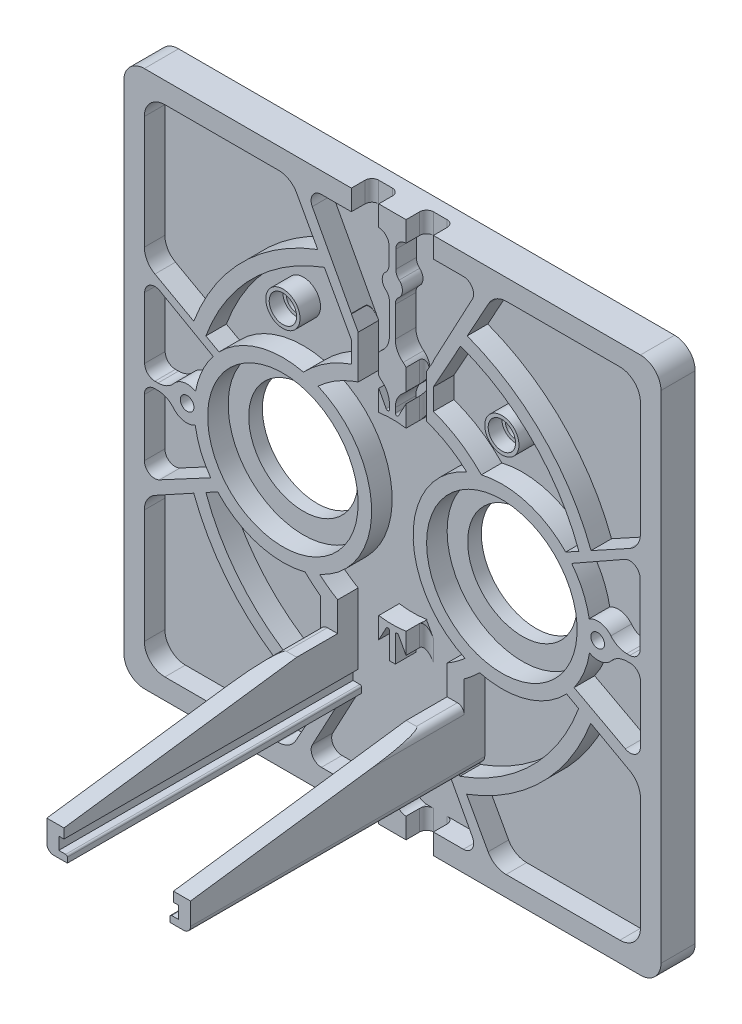
from build123d import *

# Parameters (mm, degrees)
EXTRUDE_2_DEPTH          = 5
SKETCH_6_R               = 13
CUT_EXTRUDE_2_DEPTH      = 3
CUT_EXTRUDE_4_DEPTH      = 3
SKETCH_12_R              = 18
SKETCH_12_R_2            = 16
EXTRUDE_7_DEPTH          = 3
SKETCH_18_R              = 31
SKETCH_18_R_2            = 29
EXTRUDE_10_DEPTH         = 3
CUT_EXTRUDE_7_DEPTH      = 3
CUT_EXTRUDE_7_DEPTH_BACK = 2
SKETCH_19_R              = 1
CHAMFER_6_SIZE           = 2
CUT_EXTRUDE_8_DEPTH      = 3
CUT_EXTRUDE_12_DEPTH     = 78.5
EXTRUDE_12_DEPTH         = 3
EXTRUDE_15_DEPTH         = 43
CUT_EXTRUDE_13_DEPTH     = 22
CUT_EXTRUDE_START        = -3
CUT_EXTRUDE_17_DEPTH     = 3
EXTRUDE_14_DEPTH         = 3
EXTRUDE_16_DEPTH         = 3
SKETCH_50_R              = 11
CUT_EXTRUDE_18_DEPTH     = 3
SKETCH_48_R              = 8.001672056
SKETCH_48_R_2            = 8
CUT_EXTRUDE_19_DEPTH     = 3
SKETCH_51_R              = 2.5
EXTRUDE_17_DEPTH         = 3
SKETCH_53_R              = 2
CUT_EXTRUDE_21_DEPTH     = 2
SKETCH_54_R              = 1.5
CUT_EXTRUDE_22_DEPTH     = 3


with BuildPart() as part:
    # Эскиз1 → Бобышка-Вытянуть2 (new body)
    with BuildSketch(Plane.XY):
        with BuildLine():
            Line((-36.25, -39.25), (36.25, -39.25))
            ThreePointArc((36.25, -39.25), (38.371320344, -38.371320344), (39.25, -36.25))
            Line((39.25, -36.25), (39.25, 36.25))
            ThreePointArc((39.25, 36.25), (38.371320344, 38.371320344), (36.25, 39.25))
            Line((36.25, 39.25), (-36.25, 39.25))
            ThreePointArc((-36.25, 39.25), (-38.371320344, 38.371320344), (-39.25, 36.25))
            Line((-39.25, 36.25), (-39.25, -36.25))
            ThreePointArc((-39.25, -36.25), (-38.371320344, -38.371320344), (-36.25, -39.25))
        make_face()
    extrude(amount=EXTRUDE_2_DEPTH)

    # Эскиз6 → Вырез-Вытянуть2 (cut)
    with BuildSketch(Plane.XY.offset(5)):
        Circle(SKETCH_6_R)
    extrude(amount=-CUT_EXTRUDE_2_DEPTH, mode=Mode.SUBTRACT)

    # Эскиз10 → Вырез-Вытянуть4 (cut)
    with BuildSketch(Plane.XY.offset(5)):
        with BuildLine():
            Line((-36.25, -33.25), (-36.25, -16.619482512))
            ThreePointArc((-36.25, -16.619482512), (-35.831646193, -15.091378152), (-34.69326471, -13.989465977))
            Line((-34.69326471, -13.989465977), (-12.845232579, -2))
            Line((-12.845232579, -2), (-2, -12.845232579))
            Line((-2, -12.845232579), (-14.087577933, -34.701877693))
            ThreePointArc((-14.087577933, -34.701877693), (-15.18897836, -35.834147159), (-16.712849569, -36.25))
            Line((-16.712849569, -36.25), (-33.25, -36.25))
            ThreePointArc((-33.25, -36.25), (-35.371320344, -35.371320344), (-36.25, -33.25))
        make_face()
        with BuildLine():
            Line((36.248456545, 33.245281978), (36.248456545, 16.61476449))
            ThreePointArc((36.248456545, 16.61476449), (35.830102738, 15.08666013), (34.691721255, 13.984747955))
            Line((34.691721255, 13.984747955), (12.843689124, 1.995281978))
            Line((12.843689124, 1.995281978), (1.998456545, 12.840514557))
            Line((1.998456545, 12.840514557), (14.086034478, 34.697159671))
            ThreePointArc((14.086034478, 34.697159671), (15.187434905, 35.829429137), (16.711306114, 36.245281978))
            Line((16.711306114, 36.245281978), (33.248456545, 36.245281978))
            ThreePointArc((33.248456545, 36.245281978), (35.369776888, 35.366602321), (36.248456545, 33.245281978))
        make_face()
        with BuildLine():
            Line((33.245281978, -36.317324444), (16.61476449, -36.317324444))
            ThreePointArc((16.61476449, -36.317324444), (15.08666013, -35.898970637), (13.984747955, -34.760589154))
            Line((13.984747955, -34.760589154), (1.995281978, -12.912557022))
            Line((1.995281978, -12.912557022), (12.840514557, -2.067324444))
            Line((12.840514557, -2.067324444), (34.697159671, -14.154902376))
            ThreePointArc((34.697159671, -14.154902376), (35.829429137, -15.256302804), (36.245281978, -16.780174013))
            Line((36.245281978, -16.780174013), (36.245281978, -33.317324444))
            ThreePointArc((36.245281978, -33.317324444), (35.366602321, -35.438644787), (33.245281978, -36.317324444))
        make_face()
        with BuildLine():
            Line((-33.25, 36.181132101), (-16.619482512, 36.181132101))
            ThreePointArc((-16.619482512, 36.181132101), (-15.091378152, 35.762778294), (-13.989465977, 34.624396812))
            Line((-13.989465977, 34.624396812), (-2, 12.77636468))
            Line((-2, 12.77636468), (-12.845232579, 1.931132101))
            Line((-12.845232579, 1.931132101), (-34.701877693, 14.018710034))
            ThreePointArc((-34.701877693, 14.018710034), (-35.834147159, 15.120110462), (-36.25, 16.64398167))
            Line((-36.25, 16.64398167), (-36.25, 33.181132101))
            ThreePointArc((-36.25, 33.181132101), (-35.371320344, 35.302452445), (-33.25, 36.181132101))
        make_face()
    extrude(amount=-CUT_EXTRUDE_4_DEPTH, mode=Mode.SUBTRACT)

    # Эскиз12 → Бобышка-Вытянуть7 (add)
    with BuildSketch(Plane.XY.offset(2)):
        Circle(SKETCH_12_R)
        Circle(SKETCH_12_R_2, mode=Mode.SUBTRACT)
    extrude(amount=EXTRUDE_7_DEPTH)

    # Эскиз18 → Бобышка-Вытянуть10 (add)
    with BuildSketch(Plane.XY.offset(2)):
        Circle(SKETCH_18_R)
        Circle(SKETCH_18_R_2, mode=Mode.SUBTRACT)
    extrude(amount=EXTRUDE_10_DEPTH)

    # Эскиз19 → Вырез-Вытянуть7 (cut, two sides: drawn at the far end of the back side and taken through both)
    with BuildSketch(Plane.XY.offset(2).offset(-CUT_EXTRUDE_7_DEPTH_BACK)):
        with Locations((-30, 0)):
            Circle(SKETCH_19_R)
        with Locations((30, 0)):
            Circle(SKETCH_19_R)
    extrude(amount=CUT_EXTRUDE_7_DEPTH + CUT_EXTRUDE_7_DEPTH_BACK, mode=Mode.SUBTRACT)

    # Фаска6
    chamfer_6_edges = [part.edges().sort_by_distance(p)[0] for p in [
        (-31, 0, 0),
        (29, 0, 0),
    ]]
    chamfer(chamfer_6_edges, length=CHAMFER_6_SIZE - 0.0001)  # a hair under: the kernel refuses the full size

    # Эскиз21 → Вырез-Вытянуть8 (cut)
    with BuildSketch(Plane.XY.offset(5)):
        with BuildLine():
            Line((-34.704620743, 0.454307302), (-34.254311921, 0.454307302))
            ThreePointArc((-34.254311921, 0.454307302), (-32.975007388, 0.740752454), (-31.940003243, 1.545387361))
            ThreePointArc((-31.940003243, 1.545387361), (-29.988572961, 2.454516411), (-28.054079136, 1.509884517))
            ThreePointArc((-28.054079136, 1.509884517), (-27.009013247, 0.674298621), (-25.704595988, 0.376201124))
            Line((-25.704595988, 0.376201124), (-13.943899103, 0.378878245))
            ThreePointArc((-13.943899103, 0.378878245), (-13.702182333, 0.565274083), (-13.820883988, 0.84648632))
            Line((-13.820883988, 0.84648632), (-33.966188607, 12.240012563))
            ThreePointArc((-33.966188607, 12.240012563), (-35.460382543, 12.23005852), (-36.204620743, 10.934364073))
            Line((-36.204620743, 10.934364073), (-36.204620743, 1.954307302))
            ThreePointArc((-36.204620743, 1.954307302), (-35.765280915, 0.89364713), (-34.704620743, 0.454307302))
        make_face()
        with BuildLine():
            Line((-25.761044938, -0.43461173), (-13.989761952, -0.43461173))
            ThreePointArc((-13.989761952, -0.43461173), (-13.747273757, -0.623788417), (-13.871770468, -0.905015927))
            Line((-13.871770468, -0.905015927), (-34.04205417, -11.703003176))
            ThreePointArc((-34.04205417, -11.703003176), (-35.520741889, -11.667419743), (-36.250003072, -10.380577998))
            Line((-36.250003072, -10.380577998), (-36.250003072, -2.005063818))
            ThreePointArc((-36.250003072, -2.005063818), (-35.810660174, -0.944400576), (-34.749994387, -0.505063818))
            Line((-34.749994387, -0.505063818), (-34.295230554, -0.505066451))
            ThreePointArc((-34.295230554, -0.505066451), (-33.017657052, -0.79070436), (-31.983362839, -1.593212023))
            ThreePointArc((-31.983362839, -1.593212023), (-30.03615371, -2.499914811), (-28.104179663, -1.56118715))
            ThreePointArc((-28.104179663, -1.56118715), (-27.060992294, -0.730885252), (-25.761044938, -0.43461173))
        make_face()
        with BuildLine():
            Line((-0.495022641, -34.75006596), (-0.495022641, -32.204632927))
            ThreePointArc((-0.495022641, -32.204632927), (-0.623947966, -31.596229906), (-0.988561622, -31.092411628))
            ThreePointArc((-0.988561622, -31.092411628), (-1.473098084, -29.976854334), (-0.953653161, -28.877117715))
            ThreePointArc((-0.953653161, -28.877117715), (-0.563252055, -28.363667136), (-0.424570548, -27.733737013))
            Line((-0.424570548, -27.733737013), (-0.424570548, -13.98982484))
            ThreePointArc((-0.424570548, -13.98982484), (-0.613747234, -13.747336645), (-0.894974744, -13.871833356))
            Line((-0.894974744, -13.871833356), (-11.692961993, -34.042117058))
            ThreePointArc((-11.692961993, -34.042117058), (-11.65737856, -35.520804777), (-10.370536815, -36.25006596))
            Line((-10.370536815, -36.25006596), (-1.995022641, -36.25006596))
            ThreePointArc((-1.995022641, -36.25006596), (-0.934362469, -35.810726132), (-0.495022641, -34.75006596))
        make_face()
        with BuildLine():
            Line((0.43452545, -27.733740085), (0.43452545, -13.989827912))
            ThreePointArc((0.43452545, -13.989827912), (0.623702136, -13.747339717), (0.904929646, -13.871836428))
            Line((0.904929646, -13.871836428), (11.702916895, -34.04212013))
            ThreePointArc((11.702916895, -34.04212013), (11.667333462, -35.520807849), (10.380491717, -36.250069033))
            Line((10.380491717, -36.250069033), (2.004977543, -36.250069033))
            ThreePointArc((2.004977543, -36.250069033), (0.944317371, -35.810729204), (0.504977543, -34.750069033))
            Line((0.504977543, -34.750069033), (0.504977543, -32.204635999))
            ThreePointArc((0.504977543, -32.204635999), (0.633902868, -31.596232978), (0.998516524, -31.0924147))
            ThreePointArc((0.998516524, -31.0924147), (1.483052986, -29.976857406), (0.963608063, -28.877120787))
            ThreePointArc((0.963608063, -28.877120787), (0.573206957, -28.363670209), (0.43452545, -27.733740085))
        make_face()
        with BuildLine():
            Line((0.492820643, 34.75379854), (0.492820643, 32.208365506))
            ThreePointArc((0.492820643, 32.208365506), (0.621745968, 31.599962486), (0.986359624, 31.096144208))
            ThreePointArc((0.986359624, 31.096144208), (1.470896087, 29.980586914), (0.951451164, 28.880850294))
            ThreePointArc((0.951451164, 28.880850294), (0.561050057, 28.367399716), (0.42236855, 27.737469593))
            Line((0.42236855, 27.737469593), (0.42236855, 23.323589505))
            ThreePointArc((0.42236855, 23.323589505), (0.72472932, 22.011056615), (1.570863607, 20.963096029))
            ThreePointArc((1.570863607, 20.963096029), (2.52600545, 19), (1.570863607, 17.036903971))
            ThreePointArc((1.570863607, 17.036903971), (0.72472932, 15.988943385), (0.42236855, 14.676410495))
            Line((0.42236855, 14.676410495), (0.42236855, 13.993557419))
            ThreePointArc((0.42236855, 13.993557419), (0.611545237, 13.751069225), (0.892772746, 13.875565935))
            Line((0.892772746, 13.875565935), (11.690759995, 34.045849637))
            ThreePointArc((11.690759995, 34.045849637), (11.655176563, 35.524537356), (10.368334817, 36.25379854))
            Line((10.368334817, 36.25379854), (1.992820643, 36.25379854))
            ThreePointArc((1.992820643, 36.25379854), (0.932160471, 35.814458712), (0.492820643, 34.75379854))
        make_face()
        with BuildLine():
            Line((-2.00717954, 36.253801612), (-10.382693714, 36.253801612))
            ThreePointArc((-10.382693714, 36.253801612), (-11.669535459, 35.524540429), (-11.705118892, 34.04585271))
            Line((-11.705118892, 34.04585271), (-0.907131643, 13.875569008))
            ThreePointArc((-0.907131643, 13.875569008), (-0.625904134, 13.751072297), (-0.436727447, 13.993560492))
            Line((-0.436727447, 13.993560492), (-0.436727447, 14.729814514))
            ThreePointArc((-0.436727447, 14.729814514), (-0.727107542, 16.017432459), (-1.542034095, 17.055784657))
            ThreePointArc((-1.542034095, 17.055784657), (-2.465929938, 19), (-1.542034095, 20.944215343))
            ThreePointArc((-1.542034095, 20.944215343), (-0.727107542, 21.982567541), (-0.436727447, 23.270185486))
            Line((-0.436727447, 23.270185486), (-0.436727447, 27.737472665))
            ThreePointArc((-0.436727447, 27.737472665), (-0.575408954, 28.367402788), (-0.965810061, 28.880853367))
            ThreePointArc((-0.965810061, 28.880853367), (-1.485254984, 29.980589986), (-1.000718521, 31.09614728))
            ThreePointArc((-1.000718521, 31.09614728), (-0.636104865, 31.599965558), (-0.50717954, 32.208368579))
            Line((-0.50717954, 32.208368579), (-0.50717954, 34.753801612))
            ThreePointArc((-0.50717954, 34.753801612), (-0.946519368, 35.814461784), (-2.00717954, 36.253801612))
        make_face()
        with BuildLine():
            Line((34.749994387, -0.505063818), (34.295230554, -0.505066451))
            ThreePointArc((34.295230554, -0.505066451), (33.017657052, -0.79070436), (31.983362839, -1.593212023))
            ThreePointArc((31.983362839, -1.593212023), (30.03615371, -2.499914811), (28.104179663, -1.56118715))
            ThreePointArc((28.104179663, -1.56118715), (27.060992294, -0.730885252), (25.761044938, -0.43461173))
            Line((25.761044938, -0.43461173), (13.989761952, -0.43461173))
            ThreePointArc((13.989761952, -0.43461173), (13.747273757, -0.623788417), (13.871770468, -0.905015927))
            Line((13.871770468, -0.905015927), (34.04205417, -11.703003176))
            ThreePointArc((34.04205417, -11.703003176), (35.520741889, -11.667419743), (36.250003072, -10.380577998))
            Line((36.250003072, -10.380577998), (36.250003072, -2.005063818))
            ThreePointArc((36.250003072, -2.005063818), (35.810660174, -0.944400576), (34.749994387, -0.505063818))
        make_face()
        with BuildLine():
            Line((34.704620743, 0.454307302), (34.254311921, 0.454307302))
            ThreePointArc((34.254311921, 0.454307302), (32.975007388, 0.740752454), (31.940003243, 1.545387361))
            ThreePointArc((31.940003243, 1.545387361), (29.988572961, 2.454516411), (28.054079136, 1.509884517))
            ThreePointArc((28.054079136, 1.509884517), (27.009013247, 0.674298621), (25.704595988, 0.376201124))
            Line((25.704595988, 0.376201124), (13.943899103, 0.378878245))
            ThreePointArc((13.943899103, 0.378878245), (13.702182333, 0.565274083), (13.820883988, 0.84648632))
            Line((13.820883988, 0.84648632), (33.966188607, 12.240012563))
            ThreePointArc((33.966188607, 12.240012563), (35.460382543, 12.23005852), (36.204620743, 10.934364073))
            Line((36.204620743, 10.934364073), (36.204620743, 1.954307302))
            ThreePointArc((36.204620743, 1.954307302), (35.765280915, 0.89364713), (34.704620743, 0.454307302))
        make_face()
    extrude(amount=-CUT_EXTRUDE_8_DEPTH, mode=Mode.SUBTRACT)

    # Эскиз27 → Вырез-Вытянуть12 (cut)
    with BuildSketch(Plane(origin=(0, -39.25, 0), x_dir=(-1, 0, 0), z_dir=(0, -1, 0))):
        with BuildLine():
            Line((1.995022641, -5), (5.993158737, -5))
            Line((5.993158737, -5), (5.993158737, -3))
            ThreePointArc((5.993158737, -3), (5.700265518, -2.292893219), (4.993158737, -2))
            Line((4.993158737, -2), (2.995022641, -2))
            ThreePointArc((2.995022641, -2), (2.28791586, -2.292893219), (1.995022641, -3))
            Line((1.995022641, -3), (1.995022641, -5))
        make_face()
        with BuildLine():
            Line((-1.995022641, -3), (-1.995022641, -5))
            Line((-1.995022641, -5), (-5.993158737, -5))
            Line((-5.993158737, -5), (-5.993158737, -3))
            ThreePointArc((-5.993158737, -3), (-5.700265518, -2.292893219), (-4.993158737, -2))
            Line((-4.993158737, -2), (-2.995022641, -2))
            ThreePointArc((-2.995022641, -2), (-2.28791586, -2.292893219), (-1.995022641, -3))
        make_face()
    extrude(amount=-CUT_EXTRUDE_12_DEPTH, mode=Mode.SUBTRACT)

    # Эскиз28 → Бобышка-Вытянуть12 (add)
    with BuildSketch(Plane.XY.offset(2)):
        Polygon((-5.993158737, -14.835162566), (-5.993158737, -23.395072746), (-4.993158737, -21.527105759), (-4.993158737, -15.200933058), align=None)
        Polygon((5.993158737, -14.835162566), (5.993158737, -23.37648039), (4.993158737, -21.508513403), (4.993158737, -15.200933058), align=None)
        Polygon((-4.993158737, 15.200933058), (-4.993158737, 21.508132724), (-5.993158737, 23.312460433), (-5.993158737, 14.835162566), align=None)
        Polygon((5.993158737, 14.835162566), (5.993158737, 23.312460433), (4.993158737, 21.534951597), (4.993158737, 15.200933058), align=None)
    extrude(amount=EXTRUDE_12_DEPTH)

    # Эскиз22 → Бобышка-Вытянуть15 (add)
    with BuildSketch(Plane(origin=(0, 48.415106794, 2), x_dir=(1, 0, 0), z_dir=(0, 0, 1))):
        with BuildLine():
            Line((-8.75, -74.361359055), (-7.75, -74.361359055))
            ThreePointArc((-7.75, -74.361359055), (-7.573223305, -74.43458236), (-7.5, -74.611359055))
            Line((-7.5, -74.611359055), (-7.5, -75.361359055))
            Line((-7.5, -75.361359055), (-9.5, -75.361359055))
            ThreePointArc((-9.5, -75.361359055), (-10.207106781, -75.068465837), (-10.5, -74.361359055))
            Line((-10.5, -74.361359055), (-10.5, -72.061359055))
            Line((-10.5, -72.061359055), (-10.5, -71.561359055))
            Line((-10.5, -71.561359055), (-10.5, -67.557480056))
            ThreePointArc((-10.5, -67.557480056), (-10.207106781, -66.850373275), (-9.5, -66.557480056))
            Line((-9.5, -66.557480056), (-8, -66.557480056))
            Line((-8, -66.557480056), (-8, -72.561359055))
            Line((-8, -72.561359055), (-8.75, -72.561359055))
            Line((-8.75, -72.561359055), (-8.75, -74.361359055))
        make_face()
        with BuildLine():
            Line((9.5, -66.557480056), (8, -66.557480056))
            Line((8, -66.557480056), (8, -72.561359055))
            Line((8, -72.561359055), (8.75, -72.561359055))
            Line((8.75, -72.561359055), (8.75, -74.361359055))
            Line((8.75, -74.361359055), (7.75, -74.361359055))
            ThreePointArc((7.75, -74.361359055), (7.573223305, -74.43458236), (7.5, -74.611359055))
            Line((7.5, -74.611359055), (7.5, -75.361359055))
            Line((7.5, -75.361359055), (9.5, -75.361359055))
            ThreePointArc((9.5, -75.361359055), (10.207106781, -75.068465837), (10.5, -74.361359055))
            Line((10.5, -74.361359055), (10.5, -72.061359055))
            Line((10.5, -72.061359055), (10.5, -71.561359055))
            Line((10.5, -71.561359055), (10.5, -67.557480056))
            ThreePointArc((10.5, -67.557480056), (10.207106781, -66.850373275), (9.5, -66.557480056))
        make_face()
    extrude(amount=EXTRUDE_15_DEPTH)

    # Эскиз36 → Вырез-Вытянуть13 (cut)
    with BuildSketch(Plane.ZY.offset(10.5)):
        Polygon((48, -17.360626583), (5.199581412, -17.360626583), (48, -23.143489845), align=None)
    extrude(amount=-CUT_EXTRUDE_13_DEPTH, mode=Mode.SUBTRACT)

    # Эскиз43 → Вырез-Вытянуть17 (cut)
    with BuildSketch(Plane.XY.offset(5).offset(CUT_EXTRUDE_START)):
        with BuildLine():
            Line((-7.5, -26.196252262), (-7.5, -26.946252262))
            Line((-7.5, -26.946252262), (7.5, -26.946252262))
            Line((7.5, -26.946252262), (7.5, -26.196252262))
            ThreePointArc((7.5, -26.196252262), (7.573223305, -26.019475567), (7.75, -25.946252262))
            Line((7.75, -25.946252262), (8.75, -25.946252262))
            Line((8.75, -25.946252262), (8.75, -24.146252262))
            Line((8.75, -24.146252262), (8, -24.146252262))
            Line((8, -24.146252262), (8, -13.004110539))
            Line((8, -13.004110539), (4.221795278, -15.022761917))
            Line((4.221795278, -15.022761917), (2.995022641, -17.776061141))
            Line((2.995022641, -17.776061141), (-2.995022641, -17.794653497))
            Line((-2.995022641, -17.794653497), (-4.634807155, -13.895300362))
            Line((-4.634807155, -13.895300362), (-8, -12.998727574))
            Line((-8, -12.998727574), (-8, -24.146252262))
            Line((-8, -24.146252262), (-8.75, -24.146252262))
            Line((-8.75, -24.146252262), (-8.75, -25.946252262))
            Line((-8.75, -25.946252262), (-7.75, -25.946252262))
            ThreePointArc((-7.75, -25.946252262), (-7.573223305, -26.019475567), (-7.5, -26.196252262))
        make_face()
    extrude(amount=CUT_EXTRUDE_17_DEPTH, mode=Mode.SUBTRACT)

    # Эскиз45 → Бобышка-Вытянуть14 (add)
    with BuildSketch(Plane.XY.offset(2)):
        Polygon((-10.5, -19.142373262), (-8, -19.142373262), (-8, -16.124515497), (-10.5, -13.72569562), align=None)
        Polygon((10.5, -19.142373262), (8, -19.142373262), (8, -16.124515497), (10.5, -13.72569562), align=None)
    extrude(amount=EXTRUDE_14_DEPTH)

    # Эскиз49 → Бобышка-Вытянуть16 (add)
    with BuildSketch(Plane.XY.offset(2)):
        with BuildLine():
            Line((-28.765310753, 2.121930133), (-28.260679951, 0.231673611))
            Line((-28.260679951, 0.231673611), (-28.812406489, -2.168295382))
            ThreePointArc((-28.812406489, -2.168295382), (-3.032486223, -0.305921918), (-28.765310753, 2.121930133))
        make_face()
        with BuildLine():
            Line((28.765310753, 2.121930133), (28.260679951, 0.231673611))
            Line((28.260679951, 0.231673611), (28.812406489, -2.168295382))
            ThreePointArc((28.812406489, -2.168295382), (3.032486223, -0.305921918), (28.765310753, 2.121930133))
        make_face()
    extrude(amount=EXTRUDE_16_DEPTH)

    # Эскиз50 → Вырез-Вытянуть18 (cut)
    with BuildSketch(Plane.XY.offset(2)):
        with Locations((-16, -0.163571682)):
            Circle(SKETCH_50_R)
        with Locations(Location((16, -0.163571682, 0), (0, 0, 180))):
            Circle(SKETCH_50_R)
    extrude(amount=CUT_EXTRUDE_18_DEPTH, mode=Mode.SUBTRACT)

    # Эскиз48 → Вырез-Вытянуть19 (cut)
    with BuildSketch(Plane.XY.offset(2)):
        with Locations((-16, -0.163571682)):
            Circle(SKETCH_48_R)
        with Locations((16, 0)):
            Circle(SKETCH_48_R_2)
    extrude(amount=-CUT_EXTRUDE_19_DEPTH, mode=Mode.SUBTRACT)

    # Эскиз51 → Бобышка-Вытянуть17 (add)
    with BuildSketch(Plane.XY.offset(2)):
        with Locations((-16, 18.976716711)):
            Circle(SKETCH_51_R)
        with Locations((16, 18.976716711)):
            Circle(SKETCH_51_R)
    extrude(amount=EXTRUDE_17_DEPTH)

    # Эскиз53 → Вырез-Вытянуть21 (cut)
    with BuildSketch(Plane.XY.offset(5)):
        with Locations((-16, 18.976716711)):
            Circle(SKETCH_53_R)
        with Locations((16, 18.976716711)):
            Circle(SKETCH_53_R)
    extrude(amount=-CUT_EXTRUDE_21_DEPTH, mode=Mode.SUBTRACT)

    # Эскиз54 → Вырез-Вытянуть22 (cut)
    with BuildSketch(Plane.XY.offset(3)):
        with Locations((-16, 18.976716711)):
            Circle(SKETCH_54_R)
        with Locations((16, 18.976716711)):
            Circle(SKETCH_54_R)
    extrude(amount=-CUT_EXTRUDE_22_DEPTH, mode=Mode.SUBTRACT)


solid = part.part
